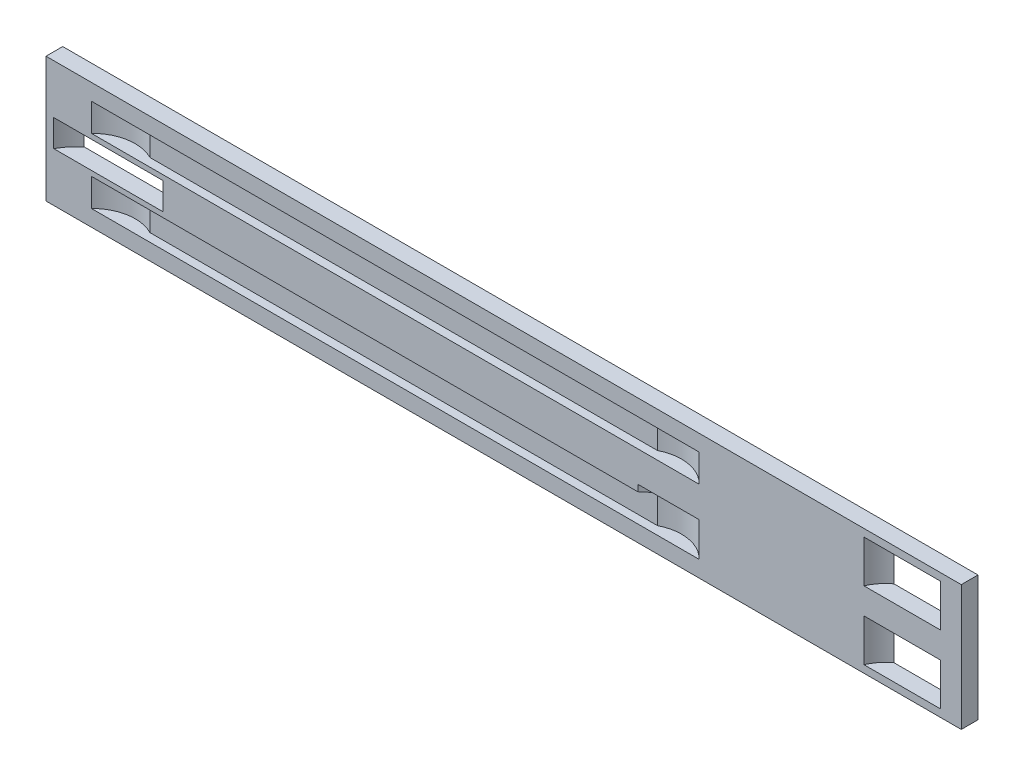
from build123d import *

# Parameters (mm, degrees)
CROQUIS1_W              = 985
CROQUIS1_H              = 135
SALIENTE_EXTRUIR1_DEPTH = 18
CROQUIS2_R              = 45
CORTAR_EXTRUIR1_DEPTH   = 45.5
CORTAR_EXTRUIR3_DEPTH   = 15
CROQUIS7_R              = 46
CORTAR_EXTRUIR4_DEPTH   = 7
CROQUIS10_R             = 67.5
CORTAR_EXTRUIR5_DEPTH   = 14.5


with BuildPart() as part:
    # Croquis1 → Saliente-Extruir1 (new body)
    with BuildSketch(Plane.XY):
        with Locations((492.5, 67.5)):
            Rectangle(CROQUIS1_W, CROQUIS1_H)
    extrude(amount=SALIENTE_EXTRUIR1_DEPTH)

    # Croquis2 → Cortar-Extruir1 (cut)
    with BuildSketch(Plane(origin=(0, 8, 0), x_dir=(-1, 0, 0), z_dir=(0, -1, 0))):
        with Locations((-921.5, -36)):
            Circle(CROQUIS2_R)
    cortar_extruir1 = extrude(amount=-CORTAR_EXTRUIR1_DEPTH, mode=Mode.SUBTRACT)

    # Simetría1: Cortar-Extruir1 across plane
    add(cortar_extruir1.mirror(Plane.ZX.offset(67.5)), mode=Mode.SUBTRACT)

    # Croquis5 → Cortar-Extruir3 (cut, symmetric)
    with BuildSketch(Plane(origin=(0, 102.5, 0), x_dir=(1, 0, 0), z_dir=(0, 1, 0))):
        with BuildLine():
            Line((102.856653615, -9), (649.052499818, -9))
            ThreePointArc((649.052499818, -9), (677.48487297, -4.628109214), (702.954576716, -18))
            Line((702.954576716, -18), (48.954576716, -18))
            ThreePointArc((48.954576716, -18), (74.424280462, -4.628109214), (102.856653615, -9))
        make_face()
    cortar_extruir3 = extrude(amount=CORTAR_EXTRUIR3_DEPTH, both=True, mode=Mode.SUBTRACT)

    # Simetría5: Cortar-Extruir3 across plane
    add(cortar_extruir3.mirror(Plane.ZX.offset(67.5)), mode=Mode.SUBTRACT)

    # Croquis7 → Cortar-Extruir4 (cut)
    with BuildSketch(Plane.XZ.offset(-47.5)):
        with Locations((669.909153433, 50)):
            Circle(CROQUIS7_R)
    extrude(amount=-CORTAR_EXTRUIR4_DEPTH, mode=Mode.SUBTRACT)

    # Croquis10 → Cortar-Extruir5 (cut, symmetric)
    with BuildSketch(Plane(origin=(0, 67.5, 0), x_dir=(1, 0, 0), z_dir=(0, 1, 0))):
        with Locations((67, -51.2)):
            Circle(CROQUIS10_R)
    extrude(amount=CORTAR_EXTRUIR5_DEPTH, both=True, mode=Mode.SUBTRACT)


solid = part.part
